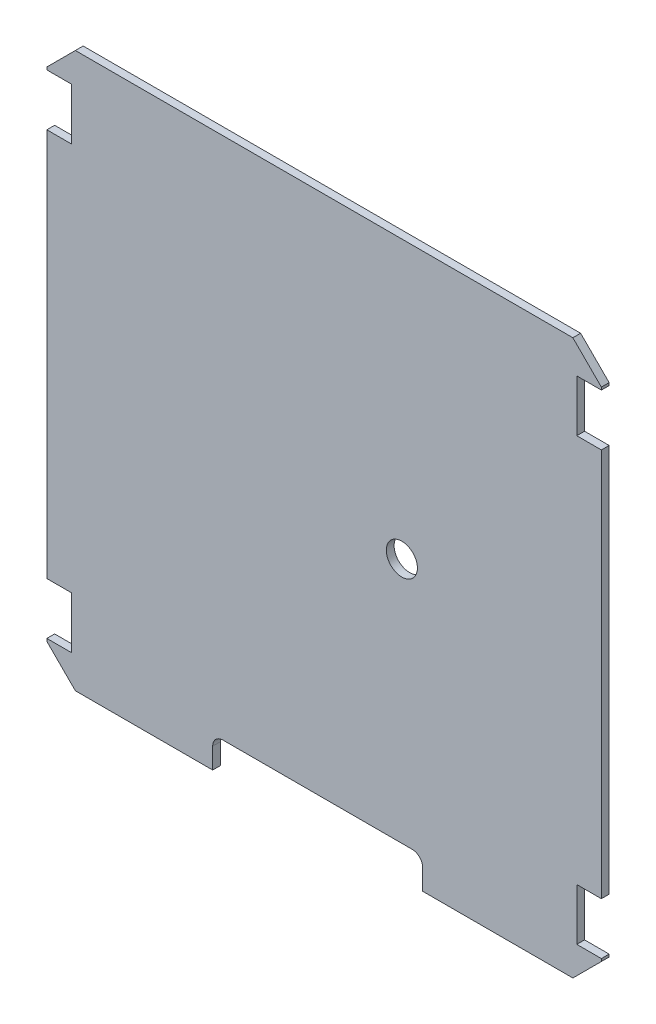
from build123d import *

# Parameters (mm, degrees)
SKETCH1_W           = 214
SKETCH1_H           = 214
SKETCH1_R           = 1.6
BOSS_EXTRUDE1_DEPTH = 3
SKETCH2_R           = 6
SKETCH2_W           = 81
SKETCH2_H           = 12
SKETCH2_W_2         = 9.494873413
SKETCH2_H_2         = 20
CUT_EXTRUDE1_DEPTH  = 152.350586388
FILLET1_R           = 4
CHAMFER1_SIZE       = 11


with BuildPart() as part:
    # Sketch1 → Boss-Extrude1 (new body)
    with BuildSketch(Plane.XY):
        Rectangle(SKETCH1_W, SKETCH1_H)
        with Locations((0, -104.5)):
            Circle(SKETCH1_R, mode=Mode.SUBTRACT)
    extrude(amount=BOSS_EXTRUDE1_DEPTH)

    # Sketch2 → Cut-Extrude1 (cut, through all)
    with BuildSketch(Plane.XY.offset(3)):
        with Locations((30, 0)):
            Circle(SKETCH2_R)
        with Locations((-2.5, -101)):
            Rectangle(SKETCH2_W, SKETCH2_H)
        with Locations((-102.252563294, -85)):
            Rectangle(SKETCH2_W_2, SKETCH2_H_2)
        with Locations((-102.252563294, 85)):
            Rectangle(SKETCH2_W_2, SKETCH2_H_2)
        with Locations((102.252563294, 85)):
            Rectangle(SKETCH2_W_2, SKETCH2_H_2)
        with Locations((102.252563294, -85)):
            Rectangle(SKETCH2_W_2, SKETCH2_H_2)
    extrude(amount=-CUT_EXTRUDE1_DEPTH, mode=Mode.SUBTRACT)

    # Fillet1
    fillet1_edges = [part.edges().sort_by_distance(p)[0] for p in [
        (38, -95, 1.5),
        (-43, -95, 1.5),
    ]]
    fillet(fillet1_edges, radius=FILLET1_R)

    # Chamfer1
    chamfer1_edges = [part.edges().sort_by_distance(p)[0] for p in [
        (107, 107, 1.5),
        (-107, 107, 1.5),
        (-107, -107, 1.5),
        (107, -107, 1.5),
    ]]
    chamfer(chamfer1_edges, length=CHAMFER1_SIZE)


solid = part.part
